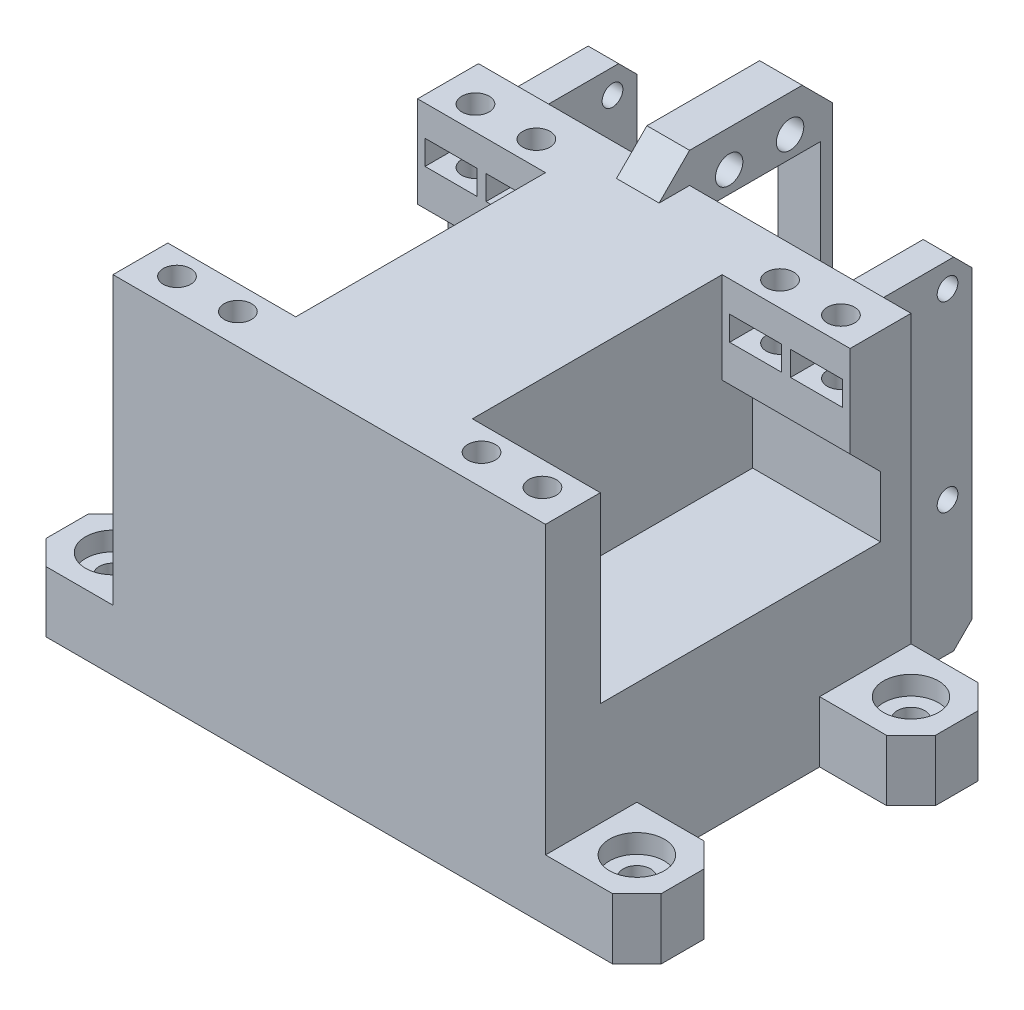
from build123d import *

# Parameters (mm, degrees)
SKETCH3_W                                = 71
SKETCH3_H                                = 60
BOSS_EXTRUDE2_DEPTH                      = 57
SKETCH4_W                                = 5
SKETCH4_H                                = 15.5
BOSS_EXTRUDE4_DEPTH                      = 52
SKETCH8_W                                = 5
SKETCH8_H                                = 15.5
BOSS_EXTRUDE5_DEPTH                      = 4
M3_CLEARANCE_HOLE1_D                     = 3.4
M3_CLEARANCE_HOLE1_DEPTH                 = 60
CHAMFER1_SIZE                            = 3
CHAMFER1_OF_MIRROR1_SIZE                 = 3
SKETCH12_W                               = 7
SKETCH12_H                               = 23.5
BOSS_EXTRUDE6_DEPTH                      = 62
CUT_EXTRUDE1_REACH                       = 89.267
SKETCH13_W                               = 20
SKETCH13_H                               = 41
M4_CLEARANCE_HOLE3_D                     = 4.5
M4_CLEARANCE_HOLE3_DEPTH                 = 7
SKETCH17_W                               = 21
SKETCH17_H                               = 41
CUT_EXTRUDE2_DEPTH                       = 30
CUT_EXTRUDE4_DEPTH                       = 21
M4_CLEARANCE_HOLE4_AT_2_COUNT            = 2
M4_CLEARANCE_HOLE4_AT_2_PITCH            = 10
M4_CLEARANCE_HOLE4_AT_3_COUNT            = 2
M4_CLEARANCE_HOLE4_AT_3_PITCH            = 50.009999
M4_CLEARANCE_HOLE4_AT_4_COUNT            = 2
M4_CLEARANCE_HOLE4_AT_4_PITCH            = 49
CUT_EXTRUDE3_DEPTH                       = 4
SHELL1_START                             = -11
SHELL1_DEPTH                             = 42
SKETCH22_W                               = 15
SKETCH22_H                               = 15
BOSS_EXTRUDE7_DEPTH                      = 10
CBORE_FOR_M4_PAN_HEAD_SCREW1_D           = 4.5
CBORE_FOR_M4_PAN_HEAD_SCREW1_CBORE_D     = 9
CBORE_FOR_M4_PAN_HEAD_SCREW1_CBORE_DEPTH = 3.1
CHAMFER2_SIZE                            = 4
CHAMFER2_OF_MIRROR3_SIZE                 = 4
CHAMFER3_SIZE                            = 5
CHAMFER4_SIZE                            = 5


# Read off the part's stored shape, not the designer's step: Shell1
with BuildPart() as part:
    # Sketch3 → Boss-Extrude2 (new body)
    with BuildSketch(Plane(origin=(0, 0, 0), x_dir=(1, 0, 0), z_dir=(0, 1, 0))):
        with Locations((0, -10)):
            Rectangle(SKETCH3_W, SKETCH3_H)
    extrude(amount=BOSS_EXTRUDE2_DEPTH)

    # Sketch4 → Boss-Extrude4 (add)
    with BuildSketch(Plane(origin=(0, 0, 0), x_dir=(1, 0, 0), z_dir=(0, 1, 0))):
        with Locations((-27.5, 27.75)):
            Rectangle(SKETCH4_W, SKETCH4_H)
    boss_extrude4 = extrude(amount=BOSS_EXTRUDE4_DEPTH)

    # Sketch8 → Boss-Extrude5 (add)
    with BuildSketch(Plane(origin=(0, 52, 0), x_dir=(1, 0, 0), z_dir=(0, 1, 0))):
        with Locations((-27.5, 27.75)):
            Rectangle(SKETCH8_W, SKETCH8_H)
    boss_extrude5 = extrude(amount=BOSS_EXTRUDE5_DEPTH)

    # M3 Clearance Hole1
    with Locations(Plane.ZY.offset(30)):
        with Locations((-31.5, 22), (-31.5, 52)):
            m3_clearance_hole1 = Hole(M3_CLEARANCE_HOLE1_D / 2, depth=M3_CLEARANCE_HOLE1_DEPTH)

    # Chamfer1
    chamfer1_edges = [part.edges().sort_by_distance(p)[0] for p in [
        (-27.5, 0, -35.5),
        (-27.5, 56, -35.5),
    ]]
    chamfer(chamfer1_edges, length=CHAMFER1_SIZE)

    # Mirror1: Boss-Extrude4, Boss-Extrude5, M3 Clearance Hole1 across plane
    add(boss_extrude4.mirror(Plane(origin=(0, 0, 0), x_dir=(0, 0, 1), z_dir=(1, 0, 0))))
    add(boss_extrude5.mirror(Plane(origin=(0, 0, 0), x_dir=(0, 0, 1), z_dir=(1, 0, 0))))
    add(m3_clearance_hole1.mirror(Plane(origin=(0, 0, 0), x_dir=(0, 0, 1), z_dir=(1, 0, 0))), mode=Mode.SUBTRACT)

    # Chamfer1 of Mirror1
    chamfer1_of_mirror1_edges = [part.edges().sort_by_distance(p)[0] for p in [
        (27.5, 0, -35.5),
        (27.5, 56, -35.5),
    ]]
    chamfer(chamfer1_of_mirror1_edges, length=CHAMFER1_OF_MIRROR1_SIZE)

    # Sketch12 → Boss-Extrude6 (add)
    with BuildSketch(Plane(origin=(0, 0, 0), x_dir=(1, 0, 0), z_dir=(0, 1, 0))):
        with Locations((-4.35, 31.75)):
            Rectangle(SKETCH12_W, SKETCH12_H)
    extrude(amount=BOSS_EXTRUDE6_DEPTH)

    # Sketch13 → Cut-Extrude1 (cut, up to next)
    with BuildSketch(Plane.ZY.offset(7.85), mode=Mode.PRIVATE) as cut_extrude1_sk1:
        with Locations((-31.5, 32)):
            Rectangle(SKETCH13_W, SKETCH13_H)
    cut_extrude1_tool1 = extrude(cut_extrude1_sk1.sketch, amount=-CUT_EXTRUDE1_REACH, mode=Mode.PRIVATE) & part.part
    add(cut_extrude1_tool1.solids().sort_by_distance((-7.85, 32, -31.5))[0], mode=Mode.SUBTRACT)

    # M4 Clearance Hole3
    with Locations(Plane.ZY.offset(7.85)):
        with Locations((-36.5, 8), (-26.5, 8), (-36.5, 56), (-26.5, 56)):
            Hole(M4_CLEARANCE_HOLE3_D / 2, depth=M4_CLEARANCE_HOLE3_DEPTH)

    # Sketch17 → Cut-Extrude2 (cut)
    with BuildSketch(Plane(origin=(0, 57, 0), x_dir=(1, 0, 0), z_dir=(0, 1, 0))):
        with Locations((-25, -10.5)):
            Rectangle(SKETCH17_W, SKETCH17_H)
        with Locations((25, -10.5)):
            Rectangle(SKETCH17_W, SKETCH17_H)
    extrude(amount=-CUT_EXTRUDE2_DEPTH, mode=Mode.SUBTRACT)

    # Sketch21 → Cut-Extrude4 (cut)
    with BuildSketch(Plane.ZY.offset(35.5)):
        Polygon((-10, 27), (-15, 27), (-15, 37), (-10, 42), align=None)
    cut_extrude4 = extrude(amount=-CUT_EXTRUDE4_DEPTH, mode=Mode.SUBTRACT)

    # Sketch18 → M4 Clearance Hole4 (revolve, cut)
    with BuildSketch(Plane(origin=(-30, 57, -14), x_dir=(0, 0, 1), z_dir=(1, 0, 0))):
        Polygon((0, 0), (0, 16.351936393), (2.25, 15), (2.25, 0), align=None)
    m4_clearance_hole4 = revolve(axis=Axis((-30, 63.35, -14), (0, -1, 0)), mode=Mode.SUBTRACT)

    # M4 Clearance Hole4 at 2: M4 Clearance Hole4 ×2
    with Locations(*[(i * M4_CLEARANCE_HOLE4_AT_2_PITCH, 0, 0) for i in range(1, M4_CLEARANCE_HOLE4_AT_2_COUNT)]):
        add(m4_clearance_hole4, mode=Mode.SUBTRACT)

    # M4 Clearance Hole4 at 3: M4 Clearance Hole4 ×2
    with Locations(*[Vector(0.19996001199600155, 0, 0.9798040587804069) * (i * M4_CLEARANCE_HOLE4_AT_3_PITCH) for i in range(1, M4_CLEARANCE_HOLE4_AT_3_COUNT)]):
        add(m4_clearance_hole4, mode=Mode.SUBTRACT)

    # M4 Clearance Hole4 at 4: M4 Clearance Hole4 ×2
    with Locations(*[(0, 0, i * M4_CLEARANCE_HOLE4_AT_4_PITCH) for i in range(1, M4_CLEARANCE_HOLE4_AT_4_COUNT)]):
        add(m4_clearance_hole4, mode=Mode.SUBTRACT)

    # Sketch20 → Cut-Extrude3 (cut)
    with BuildSketch(Plane(origin=(0, 52, 0), x_dir=(1, 0, 0), z_dir=(0, 1, 0))):
        Polygon((-34.272391992, 14), (-34.272391992, 10), (-25.727608008, 10), (-25.727608008, 14), (-27.863804004, 17.7), (-32.136195996, 17.7), align=None)
        Polygon((-24.272391992, 10), (-24.272391992, 14), (-22.136195996, 17.7), (-17.863804004, 17.7), (-15.727608008, 14), (-15.727608008, 10), align=None)
        Polygon((-15.727608008, -35), (-15.727608008, -31), (-24.272391992, -31), (-24.272391992, -35), (-22.136195996, -38.7), (-17.863804004, -38.7), align=None)
        Polygon((-25.727608008, -31), (-25.727608008, -35), (-27.863804004, -38.7), (-32.136195996, -38.7), (-34.272391992, -35), (-34.272391992, -31), align=None)
    cut_extrude3 = extrude(amount=-CUT_EXTRUDE3_DEPTH, mode=Mode.SUBTRACT)

    # Mirror2: Cut-Extrude4, M4 Clearance Hole4, Cut-Extrude3 across plane
    add(cut_extrude4.mirror(Plane(origin=(0, 0, 0), x_dir=(0, 0, 1), z_dir=(1, 0, 0))), mode=Mode.SUBTRACT)
    add(m4_clearance_hole4.mirror(Plane(origin=(0, 0, 0), x_dir=(0, 0, 1), z_dir=(1, 0, 0))), mode=Mode.SUBTRACT)
    add(cut_extrude3.mirror(Plane(origin=(0, 0, 0), x_dir=(0, 0, 1), z_dir=(1, 0, 0))), mode=Mode.SUBTRACT)

    # Mirror2 copy 1 sketch → Mirror2 copy 1 (revolve, cut)
    with BuildSketch(Plane(origin=(20, 57, -14), x_dir=(0, 0, 1), z_dir=(-1, 0, 0))):
        Polygon((0, 0), (0, -16.351936393), (2.25, -15), (2.25, 0), align=None)
    revolve(axis=Axis((20, 63.35, -14), (0, 1, 0)), mode=Mode.SUBTRACT)

    # Mirror2 copy 2 sketch → Mirror2 copy 2 (revolve, cut)
    with BuildSketch(Plane(origin=(20, 57, 35), x_dir=(0, 0, 1), z_dir=(-1, 0, 0))):
        Polygon((0, 0), (0, -16.351936393), (2.25, -15), (2.25, 0), align=None)
    revolve(axis=Axis((20, 63.35, 35), (0, 1, 0)), mode=Mode.SUBTRACT)

    # Mirror2 copy 3 sketch → Mirror2 copy 3 (revolve, cut)
    with BuildSketch(Plane(origin=(30, 57, 35), x_dir=(0, 0, 1), z_dir=(-1, 0, 0))):
        Polygon((0, 0), (0, -16.351936393), (2.25, -15), (2.25, 0), align=None)
    revolve(axis=Axis((30, 63.35, 35), (0, 1, 0)), mode=Mode.SUBTRACT)

    # Shell1 outline → Shell1 (cut)
    with BuildSketch(Plane.XY.offset(SHELL1_START)):
        Polygon((-5.5, 18), (-26.5, 18), (-26.5, 0), (26.5, 0), (26.5, 18), (5.5, 18), (5.5, 48), (-5.5, 48), align=None)
    extrude(amount=SHELL1_DEPTH, mode=Mode.SUBTRACT)

    # Sketch22 → Boss-Extrude7 (add)
    with BuildSketch(Plane(origin=(0, 0, 0), x_dir=(1, 0, 0), z_dir=(0, 1, 0))):
        with Locations((43, 12.5)):
            Rectangle(SKETCH22_W, SKETCH22_H)
        with Locations((43, -32.5)):
            Rectangle(SKETCH22_W, SKETCH22_H)
    boss_extrude7 = extrude(amount=BOSS_EXTRUDE7_DEPTH)

    # CBORE for M4 Pan Head Screw1 (through all)
    with Locations(Plane(origin=(0, 10, 0), x_dir=(1, 0, 0), z_dir=(0, 1, 0))):
        with Locations((43, 12.5), (43, -32.5)):
            cbore_for_m4_pan_head_screw1 = CounterBoreHole(CBORE_FOR_M4_PAN_HEAD_SCREW1_D / 2, CBORE_FOR_M4_PAN_HEAD_SCREW1_CBORE_D / 2, CBORE_FOR_M4_PAN_HEAD_SCREW1_CBORE_DEPTH)

    # Chamfer2
    chamfer2_edges = [part.edges().sort_by_distance(p)[0] for p in [
        (50.5, 5, 40),
        (50.5, 5, 25),
        (50.5, 5, -5),
        (50.5, 5, -20),
    ]]
    chamfer(chamfer2_edges, length=CHAMFER2_SIZE)

    # Mirror3: Boss-Extrude7, CBORE for M4 Pan Head Screw1 across plane
    add(boss_extrude7.mirror(Plane(origin=(0, 0, 0), x_dir=(0, 0, 1), z_dir=(1, 0, 0))))
    add(cbore_for_m4_pan_head_screw1.mirror(Plane(origin=(0, 0, 0), x_dir=(0, 0, 1), z_dir=(1, 0, 0))), mode=Mode.SUBTRACT)

    # Chamfer2 of Mirror3
    chamfer2_of_mirror3_edges = [part.edges().sort_by_distance(p)[0] for p in [
        (-50.5, 5, 40),
        (-50.5, 5, 25),
        (-50.5, 5, -5),
        (-50.5, 5, -20),
    ]]
    chamfer(chamfer2_of_mirror3_edges, length=CHAMFER2_OF_MIRROR3_SIZE)

    # Chamfer3
    chamfer3_edges = [part.edges().sort_by_distance(p)[0] for p in [
        (-4.35, 57, -20),
    ]]
    chamfer(chamfer3_edges, length=CHAMFER3_SIZE - 0.0001)  # a hair under: the kernel refuses the full size

    # Chamfer4
    chamfer4_edges = [part.edges().sort_by_distance(p)[0] for p in [
        (-4.35, 0, -43.5),
        (-4.35, 62, -43.5),
    ]]
    chamfer(chamfer4_edges, length=CHAMFER4_SIZE)


solid = part.part
